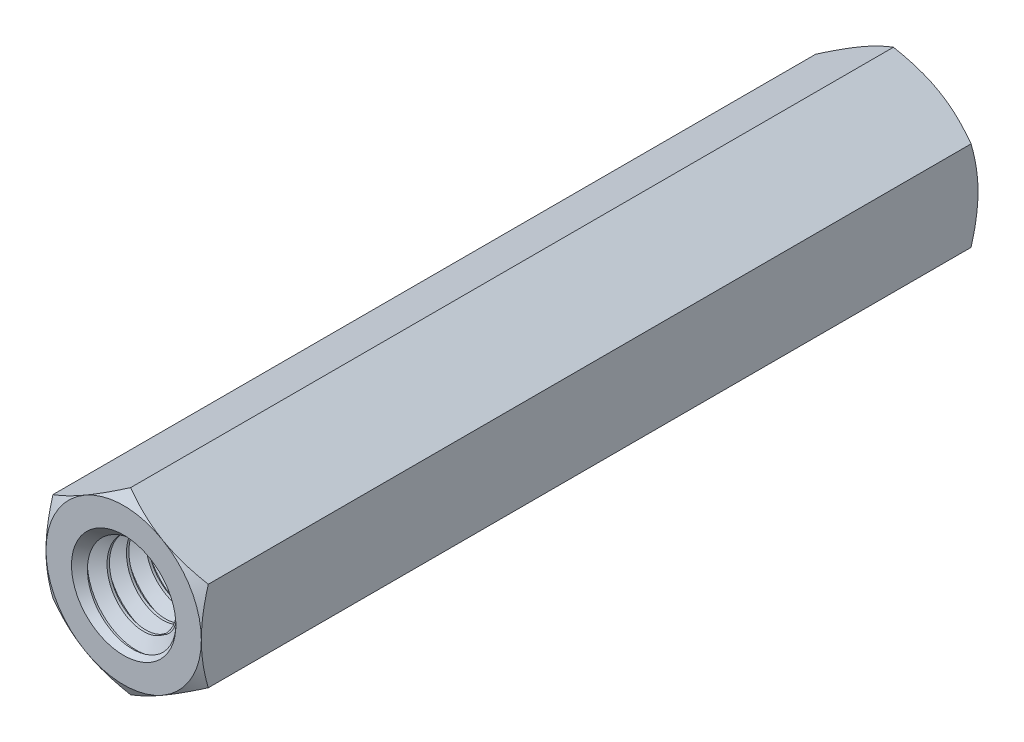
from build123d import *

# Parameters (mm, degrees)
EXTRUDE1_DEPTH          = 15.875
EXTRUDE1_DEPTH_BACK     = 15.875
SKETCH1_R               = 2.0828
SWEEP1_PITCH            = 0.79375
EXTRUDE2_DEPTH          = 33.903319039
SKETCH8_OUTSIDE_W       = 132.586
SKETCH8_OUTSIDE_H       = 133.568
SKETCH8_OUTSIDE_R       = 3.175
EXTRUDE4_DEPTH          = 33.903319039
EXTRUDE4_DRAFT          = -60
MIRROR1_COPY_1_SKETCH_W = 132.586
MIRROR1_COPY_1_SKETCH_H = 133.568
MIRROR1_COPY_1_SKETCH_R = 3.175
MIRROR1_COPY_1_DEPTH    = 33.903319039
MIRROR1_COPY_1_DRAFT    = -60
SKETCH9_W               = 12.7
SKETCH9_H               = 2.1336


with BuildPart() as part:
    # Sketch1 → Extrude1 (new, two sides: drawn at the far end of the back side and taken through both)
    with BuildSketch(Plane.XY.offset(-EXTRUDE1_DEPTH_BACK)):
        Polygon((0, 3.666174209), (-3.175, 1.833087105), (-3.175, -1.833087105), (0, -3.666174209), (3.175, -1.833087105), (3.175, 1.833087105), align=None)
        Circle(SKETCH1_R, mode=Mode.SUBTRACT)
    extrude(amount=EXTRUDE1_DEPTH + EXTRUDE1_DEPTH_BACK)

    # Sweep1: the profile of Sketch12 profile screwed along a right-hand helix of 41 turns, 8 arcs to a turn; built about Z, then put on its axis
    sweep1_z = Axis((0, 0, 0), (0, 0, 1))
    sweep1_corners = [(2.0831, 0, -0.694704455), (2.0831, 0, 0.000173205), (1.567244252, 0, -0.29765625), (1.567244252, 0, -0.396875)]
    with BuildLine(mode=Mode.PRIVATE) as sweep1_profile:
        Line(sweep1_corners[0], sweep1_corners[1])
        Line(sweep1_corners[1], sweep1_corners[2])
        Line(sweep1_corners[2], sweep1_corners[3])
        Line(sweep1_corners[3], sweep1_corners[0])
    sweep1_cap = Face(sweep1_profile.wire())
    sweep1_turn_angles = [0, 22.5, 45, 67.5, 90, 112.5, 135, 157.5, 180, 202.5, 225, 247.5, 270, 292.5, 315, 337.5, 360, 382.5, 405, 427.5, 450, 472.5, 495, 517.5, 540, 562.5, 585, 607.5, 630, 652.5, 675, 697.5, 720]
    sweep1_turn_weights = [1, 0.9238795325112867, 1, 0.9238795325112867, 1, 0.9238795325112867, 1, 0.9238795325112867, 1, 0.9238795325112867, 1, 0.9238795325112867, 1, 0.9238795325112867, 1, 0.9238795325112867, 1, 0.9238795325112867, 1, 0.9238795325112867, 1, 0.9238795325112867, 1, 0.9238795325112867, 1, 0.9238795325112867, 1, 0.9238795325112867, 1, 0.9238795325112867, 1, 0.9238795325112867, 1]
    sweep1_turn_rails = [Edge.make_bspline([Vector(p[0], p[1], 0).rotate(sweep1_z, sweep1_turn_angles[k]) / sweep1_turn_weights[k] + Vector(0, 0, p[2] + SWEEP1_PITCH * sweep1_turn_angles[k] / 360) for k in range(33)], [0, 0, 0, 1, 1, 2, 2, 3, 3, 4, 4, 5, 5, 6, 6, 7, 7, 8, 8, 9, 9, 10, 10, 11, 11, 12, 12, 13, 13, 14, 14, 15, 15, 16, 16, 16], 2, sweep1_turn_weights) for p in sweep1_corners]
    sweep1_turn_sides = [Face.make_surface_from_curves(sweep1_turn_rails[p[0]], sweep1_turn_rails[p[1]]) for p in [(0, 1), (1, 2), (2, 3), (3, 0)]]
    sweep1_last_angles = [14400, 14422.5, 14445, 14467.5, 14490, 14512.5, 14535, 14557.5, 14580, 14602.5, 14625, 14647.5, 14670, 14692.5, 14715, 14737.5, 14760]
    sweep1_last_weights = [1, 0.9238795325112867, 1, 0.9238795325112867, 1, 0.9238795325112867, 1, 0.9238795325112867, 1, 0.9238795325112867, 1, 0.9238795325112867, 1, 0.9238795325112867, 1, 0.9238795325113657, 1]
    sweep1_last_rails = [Edge.make_bspline([Vector(p[0], p[1], 0).rotate(sweep1_z, sweep1_last_angles[k]) / sweep1_last_weights[k] + Vector(0, 0, p[2] + SWEEP1_PITCH * sweep1_last_angles[k] / 360) for k in range(17)], [0, 0, 0, 1, 1, 2, 2, 3, 3, 4, 4, 5, 5, 6, 6, 7, 7, 8, 8, 8], 2, sweep1_last_weights) for p in sweep1_corners]
    sweep1_last_sides = [Face.make_surface_from_curves(sweep1_last_rails[p[0]], sweep1_last_rails[p[1]]) for p in [(0, 1), (1, 2), (2, 3), (3, 0)]]
    sweep1 = Plane(origin=(0, 0, -15.875), x_dir=(0, 1, 0), z_dir=(0, 0, 1)) * Solid(Shell([*[p.moved(Location((0, 0, 2 * SWEEP1_PITCH * i))) for i in range(20) for p in sweep1_turn_sides], *sweep1_last_sides, sweep1_cap, sweep1_cap.rotate(sweep1_z, 14760).moved(Location((0, 0, SWEEP1_PITCH * 14760 / 360)))]))
    add(sweep1)

    # Sketch6 → Extrude2 (cut, through all)
    with BuildSketch(Plane(origin=(0, 0, -15.875), x_dir=(-1, 0, 0), z_dir=(0, 0, -1))):
        Polygon((0, 3.666174209), (-3.175, 1.833087105), (-3.175, -1.833087105), (0, -3.666174209), (3.175, -1.833087105), (3.175, 1.833087105), align=None)
    extrude2 = extrude(amount=EXTRUDE2_DEPTH, mode=Mode.SUBTRACT)

    # Extrude3 cone 1 section (through the dimple's axis) → Extrude3 (revolve, cut)
    with BuildSketch(Plane(origin=(0, 0, -15.875), x_dir=(0, 1, 0), z_dir=(1, 0, 0))):
        Polygon((0, 0), (2.1336, 0), (0, 2.28800588), align=None)
    extrude3 = revolve(axis=Axis((0, 0, -15.875), (0, 0, 1)), mode=Mode.SUBTRACT)


with BuildPart() as extrude4_tool:
    # Sketch8 outside → Extrude4 (with draft: the straight prism first)
    with BuildSketch(Plane(origin=(0, 0, -15.875), x_dir=(-1, 0, 0), z_dir=(0, 0, -1))):
        Rectangle(SKETCH8_OUTSIDE_W, SKETCH8_OUTSIDE_H)
        Circle(SKETCH8_OUTSIDE_R, mode=Mode.SUBTRACT)
    extrude(amount=-EXTRUDE4_DEPTH)
    # Extrude4: the draft: its side faces are tilted about the plane it starts from
    extrude4_sides = [extrude4_tool.faces().sort_by_distance(p)[0] for p in [
        (0, -66.784, 1.07665952),
        (-66.293, 0, 1.07665952),
        (0, 66.784, 1.07665952),
        (66.293, 0, 1.07665952),
        (3.175, 0, 1.07665952),
    ]]
    draft(extrude4_sides, Plane(origin=(0, 0, -15.875), x_dir=(-1, 0, 0), z_dir=(0, 0, -1)), EXTRUDE4_DRAFT)


with BuildPart() as part_1:
    add(part.part)

    # Extrude4: cut by extrude4_tool
    add(extrude4_tool.part, mode=Mode.SUBTRACT)

    # Mirror1: Extrude2, Extrude3 across plane
    add(extrude2.mirror(Plane.XY), mode=Mode.SUBTRACT)
    add(extrude3.mirror(Plane.XY), mode=Mode.SUBTRACT)


with BuildPart() as mirror1_copy_1_tool:
    # Mirror1 copy 1 sketch → Mirror1 copy 1 (with draft: the straight prism first)
    with BuildSketch(Plane(origin=(0, 0, 15.875), x_dir=(-1, 0, 0), z_dir=(0, 0, 1))):
        Rectangle(MIRROR1_COPY_1_SKETCH_W, MIRROR1_COPY_1_SKETCH_H)
        Circle(MIRROR1_COPY_1_SKETCH_R, mode=Mode.SUBTRACT)
    extrude(amount=-MIRROR1_COPY_1_DEPTH)
    # Mirror1 copy 1: the draft: its side faces are tilted about the plane it starts from
    mirror1_copy_1_sides = [mirror1_copy_1_tool.faces().sort_by_distance(p)[0] for p in [
        (0, -66.784, -1.07665952),
        (-66.293, 0, -1.07665952),
        (0, 66.784, -1.07665952),
        (66.293, 0, -1.07665952),
        (3.175, 0, -1.07665952),
    ]]
    draft(mirror1_copy_1_sides, Plane(origin=(0, 0, 15.875), x_dir=(-1, 0, 0), z_dir=(0, 0, 1)), MIRROR1_COPY_1_DRAFT)


with BuildPart() as part_2:
    add(part_1.part)

    # Mirror1 copy 1: cut by mirror1_copy_1_tool
    add(mirror1_copy_1_tool.part, mode=Mode.SUBTRACT)

    # Sketch9 → Revolve 2 (revolve)
    with BuildSketch(Plane(origin=(0, 0, 0), x_dir=(0, 0, -1), z_dir=(1, 0, 0)), mode=Mode.PRIVATE) as revolve_2_sk:
        with Locations((0, 1.0668)):
            Rectangle(SKETCH9_W, SKETCH9_H)
    revolve(revolve_2_sk.sketch.rotate(Axis((0, 0, 15.875), (0, 0, -1)), 270), axis=Axis((0, 0, 15.875), (0, 0, -1)))


solid = part_2.part
